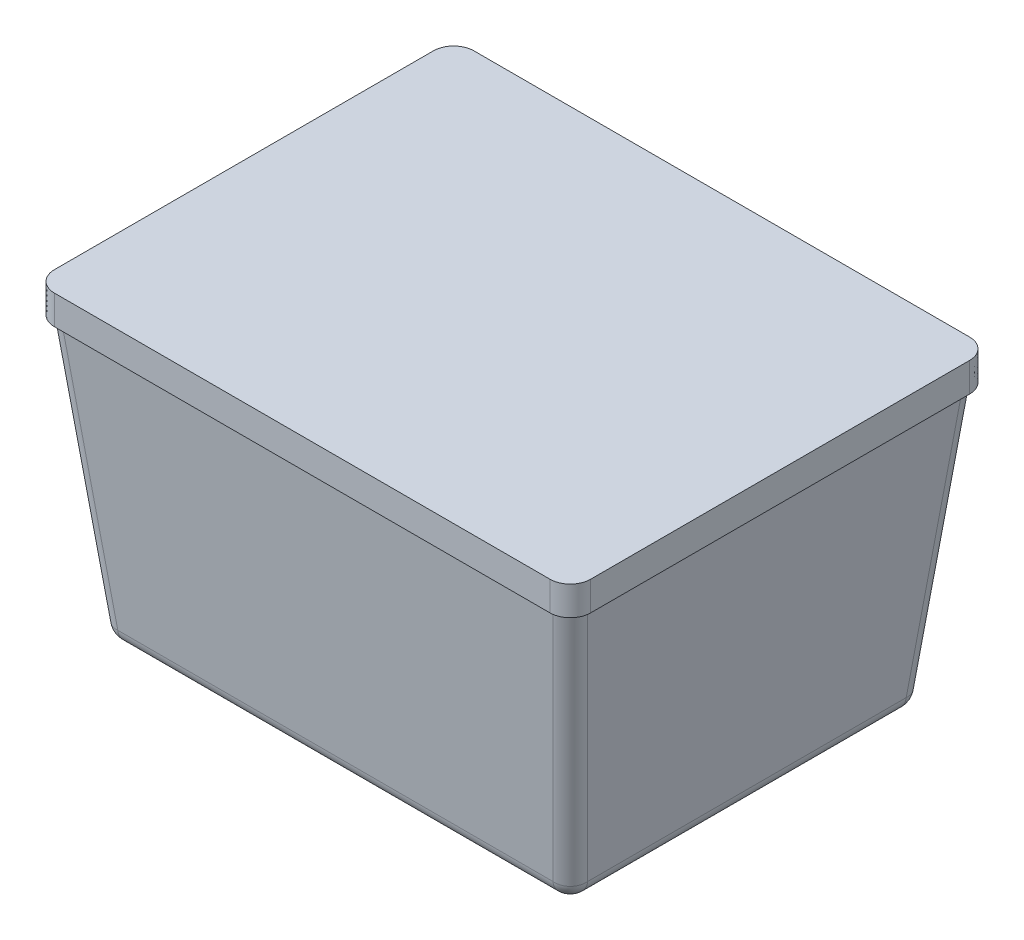
from build123d import *

# Parameters (mm, degrees)
CROQUIS1_W     = 800
CROQUIS1_H     = 600
EXTRUIR1_DEPTH = 520
EXTRUIR1_DRAFT = -6
REDONDEO1_R    = 30
VACIADO1_T     = -10
EXTRUIR2_DEPTH = 40
EXTRUIR3_DEPTH = 10


with BuildPart() as part:
    # Croquis1 → Extruir1 (with draft: the straight prism first)
    with BuildSketch(Plane(origin=(0, 0, 0), x_dir=(1, 0, 0), z_dir=(0, 1, 0))):
        Rectangle(CROQUIS1_W, CROQUIS1_H)
    extrude(amount=EXTRUIR1_DEPTH)
    # Extruir1: the draft: its side faces are tilted about the plane it starts from
    extruir1_sides = [part.faces().sort_by_distance(p)[0] for p in [
        (400, 260, 0),
        (0, 260, -300),
        (-400, 260, 0),
        (0, 260, 300),
    ]]
    draft(extruir1_sides, Plane(origin=(0, 0, 0), x_dir=(1, 0, 0), z_dir=(0, 1, 0)), EXTRUIR1_DRAFT)

    # Redondeo1
    redondeo1_edges = [part.edges().sort_by_distance(p)[0] for p in [
        (0, 0, 300),
        (400, 0, 0),
        (0, 0, -300),
        (-400, 0, 0),
        (-427.327101169, 260, -327.327101169),
        (427.327101169, 260, -327.327101169),
        (427.327101169, 260, 327.327101169),
        (-427.327101169, 260, 327.327101169),
    ]]
    fillet(redondeo1_edges, radius=REDONDEO1_R)

    # Vaciado1
    vaciado1_openings = [part.faces().sort_by_distance(p)[0] for p in [
        (0, 520, 0),
    ]]
    offset(amount=VACIADO1_T, openings=vaciado1_openings, kind=Kind.INTERSECTION)


with BuildPart() as body_2:
    # Croquis2 → Extruir2 (new body)
    with BuildSketch(Plane(origin=(0, 520, 0), x_dir=(1, 0, 0), z_dir=(0, 1, 0))):
        with BuildLine():
            Line((424.818545477, 359.654202338), (-424.818545477, 359.654202338))
            add(Edge.make_bspline(
                [(-424.818545477, 359.654202338), (-427.120086028, 359.654202338), (-429.380934681, 359.430411757), (-432.713747218, 358.773214804), (-433.814869933, 358.500171352), (-435.451518922, 358.007918705), (-435.994558337, 357.830029047), (-437.075507941, 357.446040848), (-437.613820315, 357.239674494), (-440.2615232, 356.148907719), (-442.265343116, 355.081190983), (-445.10317609, 353.193132085), (-446.020940364, 352.51569528), (-447.353923908, 351.425037779), (-447.790551127, 351.049250723), (-448.639460703, 350.281234378), (-449.053000136, 349.888002267), (-451.066995309, 347.87646125), (-452.507863424, 346.123294027), (-454.41183532, 343.276088185), (-455.005828534, 342.285067005), (-456.083159903, 340.267175368), (-456.568789235, 339.23798924), (-457.870403065, 336.091173443), (-458.532675254, 333.914517133), (-459.430368248, 329.399769105), (-459.654202338, 327.120197811), (-459.654202338, 324.818545477)],
                knots=[0, 0, 0, 0, 0.125, 0.125, 0.1875, 0.1875, 0.21875, 0.21875, 0.25, 0.25, 0.375, 0.375, 0.4375, 0.4375, 0.46875, 0.46875, 0.5, 0.5, 0.625, 0.625, 0.6875, 0.6875, 0.75, 0.75, 0.875, 0.875, 1, 1, 1, 1], degree=3))
            Line((-459.654202338, 324.818545477), (-459.654202338, -324.818545477))
            add(Edge.make_bspline(
                [(-459.654202338, -324.818545477), (-459.654202338, -327.120086028), (-459.430411757, -329.380934681), (-458.773214804, -332.713747218), (-458.500171352, -333.814869933), (-458.007918705, -335.451518922), (-457.830029047, -335.994558337), (-457.446040848, -337.075507941), (-457.239674494, -337.613820315), (-456.148907719, -340.2615232), (-455.081190983, -342.265343116), (-453.193132085, -345.10317609), (-452.51569528, -346.020940364), (-451.425037779, -347.353923908), (-451.049250723, -347.790551127), (-450.281234378, -348.639460703), (-449.888002267, -349.053000136), (-447.87646125, -351.066995309), (-446.123294027, -352.507863424), (-443.276088185, -354.41183532), (-442.285067005, -355.005828534), (-440.267175368, -356.083159903), (-439.23798924, -356.568789235), (-436.091173443, -357.870403065), (-433.914517133, -358.532675254), (-429.399769105, -359.430368248), (-427.120197811, -359.654202338), (-424.818545477, -359.654202338)],
                knots=[0, 0, 0, 0, 0.125, 0.125, 0.1875, 0.1875, 0.21875, 0.21875, 0.25, 0.25, 0.375, 0.375, 0.4375, 0.4375, 0.46875, 0.46875, 0.5, 0.5, 0.625, 0.625, 0.6875, 0.6875, 0.75, 0.75, 0.875, 0.875, 1, 1, 1, 1], degree=3))
            Line((-424.818545477, -359.654202338), (424.818545477, -359.654202338))
            add(Edge.make_bspline(
                [(424.818545477, -359.654202338), (427.120086028, -359.654202338), (429.380934681, -359.430411757), (432.713747218, -358.773214804), (433.814869933, -358.500171352), (435.451518922, -358.007918705), (435.994558337, -357.830029047), (437.075507941, -357.446040848), (437.613820315, -357.239674494), (440.2615232, -356.148907719), (442.265343116, -355.081190983), (445.10317609, -353.193132085), (446.020940364, -352.51569528), (447.353923908, -351.425037779), (447.790551127, -351.049250723), (448.639460703, -350.281234378), (449.053000136, -349.888002267), (451.066995309, -347.87646125), (452.507863424, -346.123294027), (454.41183532, -343.276088185), (455.005828534, -342.285067005), (456.083159903, -340.267175368), (456.568789235, -339.23798924), (457.870403065, -336.091173443), (458.532675254, -333.914517133), (459.430368248, -329.399769105), (459.654202338, -327.120197811), (459.654202338, -324.818545477)],
                knots=[0, 0, 0, 0, 0.125, 0.125, 0.1875, 0.1875, 0.21875, 0.21875, 0.25, 0.25, 0.375, 0.375, 0.4375, 0.4375, 0.46875, 0.46875, 0.5, 0.5, 0.625, 0.625, 0.6875, 0.6875, 0.75, 0.75, 0.875, 0.875, 1, 1, 1, 1], degree=3))
            Line((459.654202338, -324.818545477), (459.654202338, 324.818545477))
            add(Edge.make_bspline(
                [(459.654202338, 324.818545477), (459.654202338, 327.120086028), (459.430411757, 329.380934681), (458.773214804, 332.713747218), (458.500171352, 333.814869933), (458.007918705, 335.451518922), (457.830029047, 335.994558337), (457.446040848, 337.075507941), (457.239674494, 337.613820315), (456.148907719, 340.2615232), (455.081190983, 342.265343116), (453.193132085, 345.10317609), (452.51569528, 346.020940364), (451.425037779, 347.353923908), (451.049250723, 347.790551127), (450.281234378, 348.639460703), (449.888002267, 349.053000136), (447.87646125, 351.066995309), (446.123294027, 352.507863424), (443.276088185, 354.41183532), (442.285067005, 355.005828534), (440.267175368, 356.083159903), (439.23798924, 356.568789235), (436.091173443, 357.870403065), (433.914517133, 358.532675254), (429.399769105, 359.430368248), (427.120197811, 359.654202338), (424.818545477, 359.654202338)],
                knots=[0, 0, 0, 0, 0.125, 0.125, 0.1875, 0.1875, 0.21875, 0.21875, 0.25, 0.25, 0.375, 0.375, 0.4375, 0.4375, 0.46875, 0.46875, 0.5, 0.5, 0.625, 0.625, 0.6875, 0.6875, 0.75, 0.75, 0.875, 0.875, 1, 1, 1, 1], degree=3))
        make_face()
    extrude(amount=-EXTRUIR2_DEPTH)

    # Croquis3 → Extruir3 (add)
    with BuildSketch(Plane(origin=(0, 520, 0), x_dir=(1, 0, 0), z_dir=(0, 1, 0))):
        with BuildLine():
            Line((-459.654202338, 324.818545477), (-459.654202338, -324.818545477))
            add(Edge.make_bspline(
                [(-459.654202338, -324.818545477), (-459.654202338, -327.120086028), (-459.430411757, -329.380934681), (-458.773214804, -332.713747218), (-458.500171352, -333.814869933), (-458.007918705, -335.451518922), (-457.830029047, -335.994558337), (-457.446040848, -337.075507941), (-457.239674494, -337.613820315), (-456.148907719, -340.2615232), (-455.081190983, -342.265343116), (-453.193132085, -345.10317609), (-452.51569528, -346.020940364), (-451.425037779, -347.353923908), (-451.049250723, -347.790551127), (-450.281234378, -348.639460703), (-449.888002267, -349.053000136), (-447.87646125, -351.066995309), (-446.123294027, -352.507863424), (-443.276088185, -354.41183532), (-442.285067005, -355.005828534), (-440.267175368, -356.083159903), (-439.23798924, -356.568789235), (-436.091173443, -357.870403065), (-433.914517133, -358.532675254), (-429.399769105, -359.430368248), (-427.120197811, -359.654202338), (-424.818545477, -359.654202338)],
                knots=[0, 0, 0, 0, 0.125, 0.125, 0.1875, 0.1875, 0.21875, 0.21875, 0.25, 0.25, 0.375, 0.375, 0.4375, 0.4375, 0.46875, 0.46875, 0.5, 0.5, 0.625, 0.625, 0.6875, 0.6875, 0.75, 0.75, 0.875, 0.875, 1, 1, 1, 1], degree=3))
            Line((-424.818545477, -359.654202338), (424.818545477, -359.654202338))
            add(Edge.make_bspline(
                [(424.818545477, -359.654202338), (427.120086028, -359.654202338), (429.380934681, -359.430411757), (432.713747218, -358.773214804), (433.814869933, -358.500171352), (435.451518922, -358.007918705), (435.994558337, -357.830029047), (437.075507941, -357.446040848), (437.613820315, -357.239674494), (440.2615232, -356.148907719), (442.265343116, -355.081190983), (445.10317609, -353.193132085), (446.020940364, -352.51569528), (447.353923908, -351.425037779), (447.790551127, -351.049250723), (448.639460703, -350.281234378), (449.053000136, -349.888002267), (451.066995309, -347.87646125), (452.507863424, -346.123294027), (454.41183532, -343.276088185), (455.005828534, -342.285067005), (456.083159903, -340.267175368), (456.568789235, -339.23798924), (457.870403065, -336.091173443), (458.532675254, -333.914517133), (459.430368248, -329.399769105), (459.654202338, -327.120197811), (459.654202338, -324.818545477)],
                knots=[0, 0, 0, 0, 0.125, 0.125, 0.1875, 0.1875, 0.21875, 0.21875, 0.25, 0.25, 0.375, 0.375, 0.4375, 0.4375, 0.46875, 0.46875, 0.5, 0.5, 0.625, 0.625, 0.6875, 0.6875, 0.75, 0.75, 0.875, 0.875, 1, 1, 1, 1], degree=3))
            Line((459.654202338, -324.818545477), (459.654202338, 324.818545477))
            add(Edge.make_bspline(
                [(459.654202338, 324.818545477), (459.654202338, 327.120086028), (459.430411757, 329.380934681), (458.773214804, 332.713747218), (458.500171352, 333.814869933), (458.007918705, 335.451518922), (457.830029047, 335.994558337), (457.446040848, 337.075507941), (457.239674494, 337.613820315), (456.148907719, 340.2615232), (455.081190983, 342.265343116), (453.193132085, 345.10317609), (452.51569528, 346.020940364), (451.425037779, 347.353923908), (451.049250723, 347.790551127), (450.281234378, 348.639460703), (449.888002267, 349.053000136), (447.87646125, 351.066995309), (446.123294027, 352.507863424), (443.276088185, 354.41183532), (442.285067005, 355.005828534), (440.267175368, 356.083159903), (439.23798924, 356.568789235), (436.091173443, 357.870403065), (433.914517133, 358.532675254), (429.399769105, 359.430368248), (427.120197811, 359.654202338), (424.818545477, 359.654202338)],
                knots=[0, 0, 0, 0, 0.125, 0.125, 0.1875, 0.1875, 0.21875, 0.21875, 0.25, 0.25, 0.375, 0.375, 0.4375, 0.4375, 0.46875, 0.46875, 0.5, 0.5, 0.625, 0.625, 0.6875, 0.6875, 0.75, 0.75, 0.875, 0.875, 1, 1, 1, 1], degree=3))
            Line((424.818545477, 359.654202338), (-424.818545477, 359.654202338))
            add(Edge.make_bspline(
                [(-424.818545477, 359.654202338), (-427.120086028, 359.654202338), (-429.380934681, 359.430411757), (-432.713747218, 358.773214804), (-433.814869933, 358.500171352), (-435.451518922, 358.007918705), (-435.994558337, 357.830029047), (-437.075507941, 357.446040848), (-437.613820315, 357.239674494), (-440.2615232, 356.148907719), (-442.265343116, 355.081190983), (-445.10317609, 353.193132085), (-446.020940364, 352.51569528), (-447.353923908, 351.425037779), (-447.790551127, 351.049250723), (-448.639460703, 350.281234378), (-449.053000136, 349.888002267), (-451.066995309, 347.87646125), (-452.507863424, 346.123294027), (-454.41183532, 343.276088185), (-455.005828534, 342.285067005), (-456.083159903, 340.267175368), (-456.568789235, 339.23798924), (-457.870403065, 336.091173443), (-458.532675254, 333.914517133), (-459.430368248, 329.399769105), (-459.654202338, 327.120197811), (-459.654202338, 324.818545477)],
                knots=[0, 0, 0, 0, 0.125, 0.125, 0.1875, 0.1875, 0.21875, 0.21875, 0.25, 0.25, 0.375, 0.375, 0.4375, 0.4375, 0.46875, 0.46875, 0.5, 0.5, 0.625, 0.625, 0.6875, 0.6875, 0.75, 0.75, 0.875, 0.875, 1, 1, 1, 1], degree=3))
        make_face()
    extrude(amount=EXTRUIR3_DEPTH)


solid = Compound([part.part, body_2.part])
